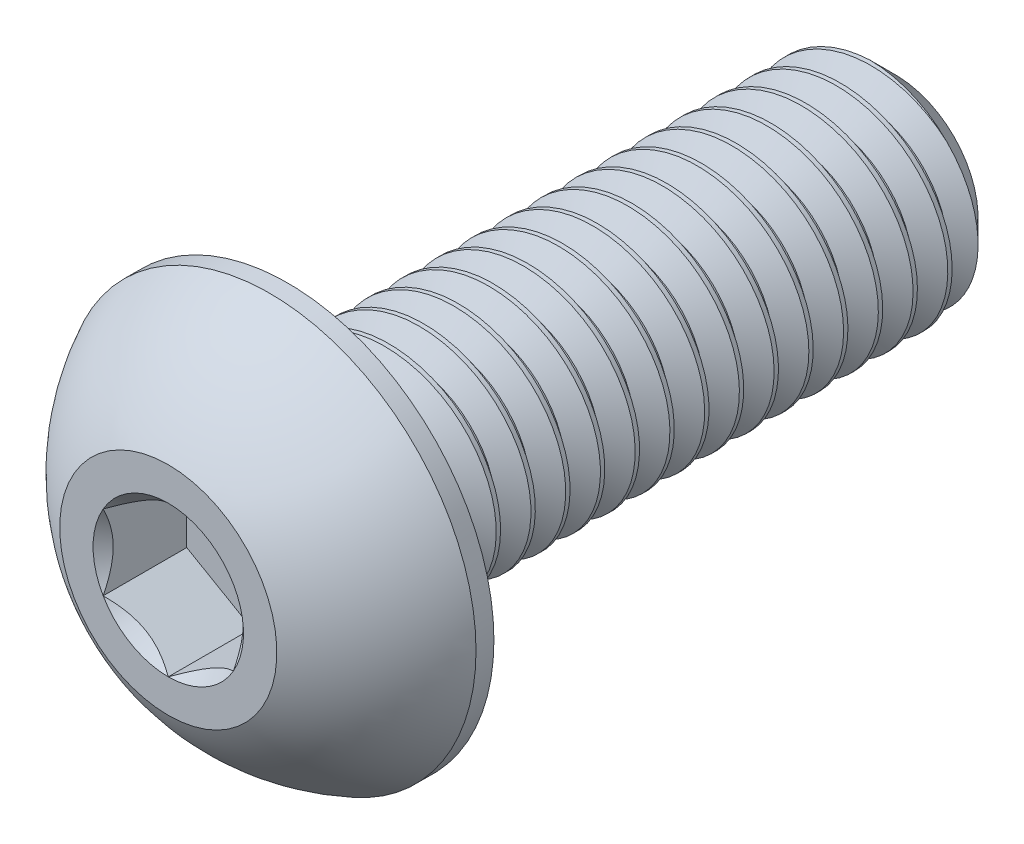
from build123d import *

# Parameters (mm, degrees)
SKETCH1_W          = 14
SKETCH1_H          = 2.5
CHAMFER1_SIZE      = 0.6
CUT_EXTRUDE2_DEPTH = 1.925
CUT_SWEEP1_PITCH   = 0.8


with BuildPart() as part:
    # Sketch1 → Revolve1 (revolve)
    with BuildSketch(Plane(origin=(0, 0, 0), x_dir=(0, 0, -1), z_dir=(1, 0, 0)), mode=Mode.PRIVATE) as revolve1_sk:
        with Locations((9.75, 1.25)):
            Rectangle(SKETCH1_W, SKETCH1_H)
    revolve(revolve1_sk.sketch.rotate(Axis((0, 0, -16.75), (0, 0, 1)), 90), axis=Axis((0, 0, -16.75), (0, 0, 1)))

    # Chamfer1
    chamfer1_edges = [part.edges().sort_by_distance(p)[0] for p in [
        (2.5, 0, -16.75),
    ]]
    chamfer(chamfer1_edges, length=CHAMFER1_SIZE)

    # Sketch7 → Revolve2 (revolve)
    with BuildSketch(Plane(origin=(0, 0, 0), x_dir=(0, 0, -1), z_dir=(1, 0, 0)), mode=Mode.PRIVATE) as revolve2_sk:
        with BuildLine():
            Line((2.3375, 4.75), (2.75, 4.75))
            Line((2.75, 4.75), (2.75, 0))
            Line((2.75, 0), (0, 0))
            Line((0, 0), (0, 2.5))
            ThreePointArc((0, 2.5), (0.991875183, 3.808753282), (2.3375, 4.75))
        make_face()
    revolve(revolve2_sk.sketch.rotate(Axis((0, 0, 0), (0, 0, -1)), 180), axis=Axis((0, 0, 0), (0, 0, -1)))

    # Sketch5 → Cut-Extrude2 (cut)
    with BuildSketch(Plane.XY):
        Polygon((1.5, -0.866025404), (1.5, 0.866025404), (0, 1.732050808), (-1.5, 0.866025404), (-1.5, -0.866025404), (0, -1.732050808), align=None)
    extrude(amount=-CUT_EXTRUDE2_DEPTH, mode=Mode.SUBTRACT)

    # Cut-Extrude3 cone 1 section (through the dimple's axis) → Cut-Extrude3 (revolve, cut)
    with BuildSketch(Plane(origin=(0, 0, 0), x_dir=(0, -1, 0), z_dir=(1, 0, 0))):
        Polygon((0, 0), (1.732050808, 0), (0, 1.732050808), align=None)
    revolve(axis=Axis((0, 0, 0), (0, 0, -1)), mode=Mode.SUBTRACT)

    # Cut-Sweep1: the profile of Sketch2 profile screwed along a right-hand helix of 18.5 turns, 8 arcs to a turn; built about Z, then put on its axis
    cut_sweep1_z = Axis((0, 0, 0), (0, 0, 1))
    cut_sweep1_corners = [(2.5003, 0, 0.600173205), (2.5003, 0, -0.100173205), (1.980384758, 0, 0.2), (1.980384758, 0, 0.3)]
    with BuildLine(mode=Mode.PRIVATE) as cut_sweep1_profile:
        Line(cut_sweep1_corners[0], cut_sweep1_corners[1])
        Line(cut_sweep1_corners[1], cut_sweep1_corners[2])
        Line(cut_sweep1_corners[2], cut_sweep1_corners[3])
        Line(cut_sweep1_corners[3], cut_sweep1_corners[0])
    cut_sweep1_cap = Face(cut_sweep1_profile.wire())
    cut_sweep1_turn_angles = [0, 22.5, 45, 67.5, 90, 112.5, 135, 157.5, 180, 202.5, 225, 247.5, 270, 292.5, 315, 337.5, 360]
    cut_sweep1_turn_weights = [1, 0.9238795325112867, 1, 0.9238795325112867, 1, 0.9238795325112867, 1, 0.9238795325112867, 1, 0.9238795325112867, 1, 0.9238795325112867, 1, 0.9238795325112867, 1, 0.9238795325112867, 1]
    cut_sweep1_turn_rails = [Edge.make_bspline([Vector(p[0], p[1], 0).rotate(cut_sweep1_z, cut_sweep1_turn_angles[k]) / cut_sweep1_turn_weights[k] + Vector(0, 0, p[2] + CUT_SWEEP1_PITCH * cut_sweep1_turn_angles[k] / 360) for k in range(17)], [0, 0, 0, 1, 1, 2, 2, 3, 3, 4, 4, 5, 5, 6, 6, 7, 7, 8, 8, 8], 2, cut_sweep1_turn_weights) for p in cut_sweep1_corners]
    cut_sweep1_turn_sides = [Face.make_surface_from_curves(cut_sweep1_turn_rails[p[0]], cut_sweep1_turn_rails[p[1]]) for p in [(0, 1), (1, 2), (2, 3), (3, 0)]]
    cut_sweep1_last_angles = [6480, 6502.5, 6525, 6547.5, 6570, 6592.5, 6615, 6637.5, 6660]
    cut_sweep1_last_weights = [1, 0.9238795325112867, 1, 0.9238795325112867, 1, 0.9238795325112867, 1, 0.9238795325112503, 1]
    cut_sweep1_last_rails = [Edge.make_bspline([Vector(p[0], p[1], 0).rotate(cut_sweep1_z, cut_sweep1_last_angles[k]) / cut_sweep1_last_weights[k] + Vector(0, 0, p[2] + CUT_SWEEP1_PITCH * cut_sweep1_last_angles[k] / 360) for k in range(9)], [0, 0, 0, 1, 1, 2, 2, 3, 3, 4, 4, 4], 2, cut_sweep1_last_weights) for p in cut_sweep1_corners]
    cut_sweep1_last_sides = [Face.make_surface_from_curves(cut_sweep1_last_rails[p[0]], cut_sweep1_last_rails[p[1]]) for p in [(0, 1), (1, 2), (2, 3), (3, 0)]]
    cut_sweep1 = Plane(origin=(0, 0, -16.75), x_dir=(0, 1, 0), z_dir=(0, 0, 1)) * Solid(Shell([*[p.moved(Location((0, 0, CUT_SWEEP1_PITCH * i))) for i in range(18) for p in cut_sweep1_turn_sides], *cut_sweep1_last_sides, cut_sweep1_cap, cut_sweep1_cap.rotate(cut_sweep1_z, 6660).moved(Location((0, 0, CUT_SWEEP1_PITCH * 6660 / 360)))]))
    add(cut_sweep1, mode=Mode.SUBTRACT)


solid = part.part
